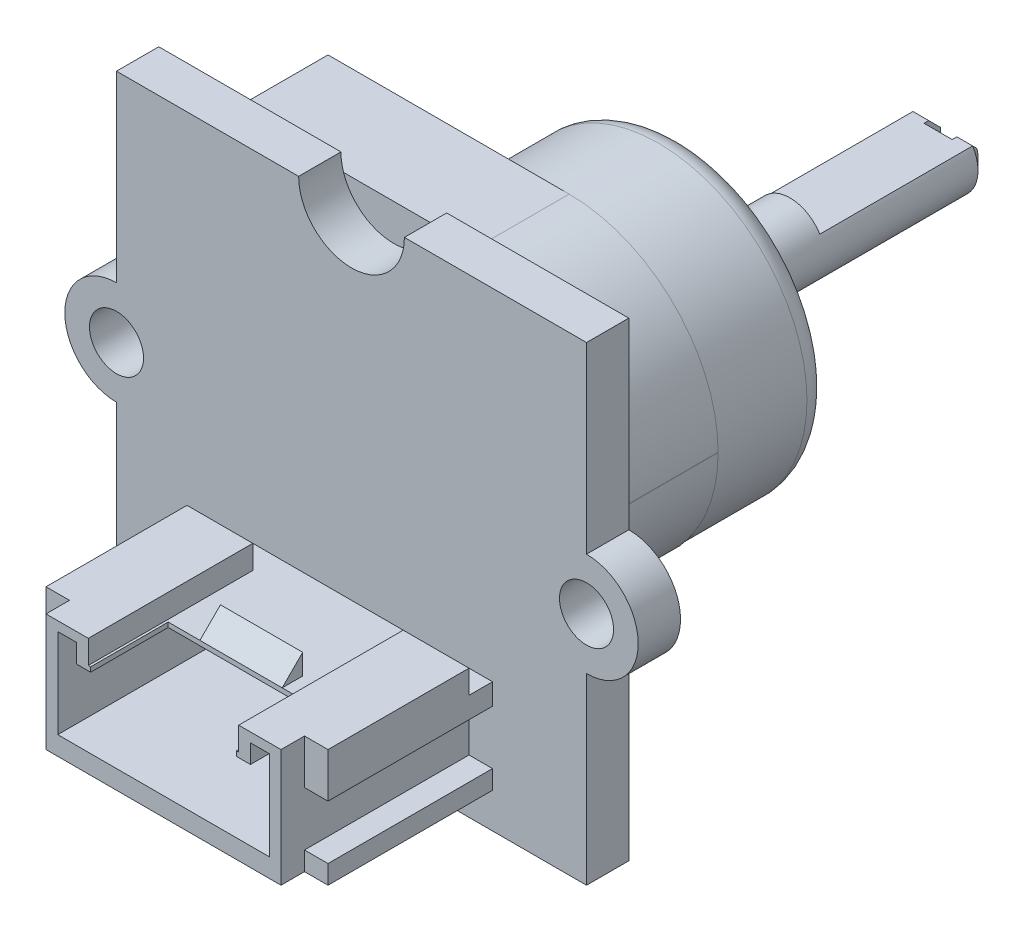
from build123d import *

# Parameters (mm, degrees)
ESQUISSE1_R             = 1.15
BOSS_EXTRU_1_DEPTH      = 1.8
BOSS_EXTRU_2_DEPTH      = 8
ENL_V_MAT_EXTRU_1_DEPTH = 7
ESQUISSE4_W             = 3.5
ESQUISSE4_H             = 0.873592076
ENL_V_MAT_EXTRU_2_DEPTH = 1
ESQUISSE5_W             = 1
ESQUISSE5_H             = 1
ENL_V_MAT_EXTRU_3_DEPTH = 11
ESQUISSE6_W             = 6.2
ESQUISSE6_H             = 3.3
ENL_V_MAT_EXTRU_4_DEPTH = 1
CHANFREIN1_SIZE         = 1
BOSS_EXTRU_3_DEPTH      = 4
ESQUISSE8_R             = 6.32
BOSS_EXTRU_4_DEPTH      = 4.8
CONG_1_R                = 1
ESQUISSE10_R            = 1.75
BOSS_EXTRU_5_DEPTH      = 1.6
CONG_2_R                = 1
ESQUISSE11_R            = 1.5
BOSS_EXTRU_6_DEPTH      = 10
ESQUISSE12_W            = 2.890262719
ESQUISSE12_H            = 1.095500593
ENL_V_MAT_EXTRU_7_DEPTH = 7
CHANFREIN2_SIZE         = 0.5
ESQUISSE13_W            = 1.2
ESQUISSE13_H            = 2.827300788
ENL_V_MAT_EXTRU_8_DEPTH = 0.7


with BuildPart() as part:
    # Esquisse1 → Boss.-Extru.1 (new body)
    with BuildSketch(Plane.XY):
        with BuildLine():
            Line((-12.744645331, 10.992907801), (-4.994645331, 10.992907801))
            ThreePointArc((-4.994645331, 10.992907801), (-2.744645331, 8.742907801), (-0.494645331, 10.992907801))
            Line((-0.494645331, 10.992907801), (7.255354669, 10.992907801))
            Line((7.255354669, 10.992907801), (7.255354669, 3.192907801))
            ThreePointArc((7.255354669, 3.192907801), (9.455354669, 0.992907801), (7.255354669, -1.207092199))
            Line((7.255354669, -1.207092199), (7.255354669, -9.007092199))
            Line((7.255354669, -9.007092199), (-0.494645331, -9.007092199))
            ThreePointArc((-0.494645331, -9.007092199), (-2.744645331, -6.757092199), (-4.994645331, -9.007092199))
            Line((-4.994645331, -9.007092199), (-12.744645331, -9.007092199))
            Line((-12.744645331, -9.007092199), (-12.744645331, -1.207092199))
            ThreePointArc((-12.744645331, -1.207092199), (-14.944645331, 0.992907801), (-12.744645331, 3.192907801))
            Line((-12.744645331, 3.192907801), (-12.744645331, 10.992907801))
        make_face()
        with Locations((-12.744645331, 0.992907801)):
            Circle(ESQUISSE1_R, mode=Mode.SUBTRACT)
        with Locations((7.255354669, 0.992907801)):
            Circle(ESQUISSE1_R, mode=Mode.SUBTRACT)
    extrude(amount=BOSS_EXTRU_1_DEPTH)

    # Esquisse2 → Boss.-Extru.2 (add)
    with BuildSketch(Plane.XY.offset(1.8)):
        Polygon((-8.744645331, -7.507092199), (3.255354669, -7.507092199), (3.255354669, -6.707092199), (2.255354669, -6.707092199), (2.255354669, -4.407092199), (3.255354669, -4.407092199), (3.255354669, -2.507092199), (-8.744645331, -2.507092199), (-8.744645331, -4.407092199), (-7.744645331, -4.407092199), (-7.744645331, -6.707092199), (-8.744645331, -6.707092199), align=None)
    extrude(amount=BOSS_EXTRU_2_DEPTH)

    # Esquisse3 → Enlèv. mat.-Extru.1 (cut)
    with BuildSketch(Plane.XY.offset(9.8)):
        Polygon((-6.444645331, -3.707092199), (0.955354669, -3.707092199), (0.955354669, -2.907092199), (1.755354669, -2.907092199), (1.755354669, -3.707092199), (1.755354669, -6.707092199), (-7.244645331, -6.707092199), (-7.244645331, -3.707092199), (-7.244645331, -2.907092199), (-6.444645331, -2.907092199), align=None)
    extrude(amount=-ENL_V_MAT_EXTRU_1_DEPTH, mode=Mode.SUBTRACT)

    # Esquisse4 → Enlèv. mat.-Extru.2 (cut)
    with BuildSketch(Plane(origin=(0, -2.507092199, 0), x_dir=(1, 0, 0), z_dir=(0, 1, 0))):
        Polygon((-8.744645331, -1.8), (3.255354669, -1.8), (3.255354669, -2.8), (0.455354669, -2.8), (0.455354669, -9.8), (-5.944645331, -9.8), (-5.944645331, -2.8), (-8.744645331, -2.8), align=None)
        with Locations((-2.744645331, -6.063203962)):
            Rectangle(ESQUISSE4_W, ESQUISSE4_H, mode=Mode.SUBTRACT)
    extrude(amount=-ENL_V_MAT_EXTRU_2_DEPTH, mode=Mode.SUBTRACT)

    # Esquisse5 → Enlèv. mat.-Extru.3 (cut)
    with BuildSketch(Plane(origin=(0, -2.507092199, 0), x_dir=(1, 0, 0), z_dir=(0, 1, 0))):
        with Locations((-8.244645331, -9.3)):
            Rectangle(ESQUISSE5_W, ESQUISSE5_H)
        with Locations((2.755354669, -9.3)):
            Rectangle(ESQUISSE5_W, ESQUISSE5_H)
    extrude(amount=-ENL_V_MAT_EXTRU_3_DEPTH, mode=Mode.SUBTRACT)

    # Esquisse6 → Enlèv. mat.-Extru.4 (cut)
    with BuildSketch(Plane(origin=(0, -3.507092199, 0), x_dir=(1, 0, 0), z_dir=(0, 1, 0))):
        with Locations((-2.744645331, -8.15)):
            Rectangle(ESQUISSE6_W, ESQUISSE6_H)
    extrude(amount=-ENL_V_MAT_EXTRU_4_DEPTH, mode=Mode.SUBTRACT)

    # Chanfrein1
    # the kernel refuses this chamfer: 1 mm, written as the material it takes off along each edge
    with BuildSketch(Plane(origin=(1.577037657, -2.507092199, 6.5), x_dir=(0, -0.9996219169112968, 0.027495876610586487), z_dir=(-1, 0, 0))) as chanfrein1_piece_1_section:
        Polygon((CHANFREIN1_SIZE * 0.999621916911, -CHANFREIN1_SIZE * 0.0274958766106), (-CHANFREIN1_SIZE * 0.0274958766106, -CHANFREIN1_SIZE * 0.999621916911), (0, 0), align=None)
    chanfrein1_piece_1 = extrude(amount=6.071682988, mode=Mode.PRIVATE)
    chanfrein1_piece_1 = split(chanfrein1_piece_1, bisect_by=Plane(origin=(0.455354669, -3.107092199, 6.3), z_dir=(-1, 0, 0)), keep=Keep.TOP, mode=Mode.PRIVATE)
    add(chanfrein1_piece_1, mode=Mode.SUBTRACT)

    # Esquisse7 → Boss.-Extru.3 (add)
    with BuildSketch(Plane(origin=(0, 0, 0), x_dir=(-1, 0, 0), z_dir=(0, 0, -1))):
        with BuildLine():
            Line((9.544645331, 10.292907801), (-0.715354669, 10.292907801))
            ThreePointArc((-0.715354669, 10.292907801), (-5.198411662, 8.435964794), (-7.055354669, 3.952907801))
            Line((-7.055354669, 3.952907801), (-7.055354669, 3.932907801))
            ThreePointArc((-7.055354669, 3.932907801), (-5.198411662, -0.550149191), (-0.715354669, -2.407092199))
            Line((-0.715354669, -2.407092199), (9.544645331, -2.407092199))
            Line((9.544645331, -2.407092199), (9.544645331, 10.292907801))
        make_face()
    extrude(amount=BOSS_EXTRU_3_DEPTH)

    # Esquisse8 → Boss.-Extru.4 (add)
    with BuildSketch(Plane(origin=(0, 0, -4), x_dir=(-1, 0, 0), z_dir=(0, 0, -1))):
        with Locations((-0.715354669, 3.952907801)):
            Circle(ESQUISSE8_R)
    extrude(amount=BOSS_EXTRU_4_DEPTH)

    # Congé1
    cong_1_edges = [part.edges().sort_by_distance(p)[0] for p in [
        (7.035354669, 3.952907801, -8.8),
    ]]
    fillet(cong_1_edges, radius=CONG_1_R)

    # Esquisse10 → Boss.-Extru.5 (add)
    with BuildSketch(Plane(origin=(0, 0, -8.8), x_dir=(-1, 0, 0), z_dir=(0, 0, -1))):
        with Locations((-0.715354669, 3.952907801)):
            Circle(ESQUISSE10_R)
    extrude(amount=BOSS_EXTRU_5_DEPTH)

    # Congé2
    cong_2_edges = [part.edges().sort_by_distance(p)[0] for p in [
        (2.465354669, 3.952907801, -8.8),
    ]]
    fillet(cong_2_edges, radius=CONG_2_R)

    # Esquisse11 → Boss.-Extru.6 (add)
    with BuildSketch(Plane(origin=(0, 0, -10.4), x_dir=(-1, 0, 0), z_dir=(0, 0, -1))):
        with Locations((-0.715354669, 3.952907801)):
            Circle(ESQUISSE11_R)
    extrude(amount=BOSS_EXTRU_6_DEPTH)

    # Esquisse12 → Enlèv. mat.-Extru.7 (cut)
    with BuildSketch(Plane(origin=(0, 0, -20.4), x_dir=(-1, 0, 0), z_dir=(0, 0, -1))):
        with Locations((-0.539081064, 5.300658098)):
            Rectangle(ESQUISSE12_W, ESQUISSE12_H)
    extrude(amount=-ENL_V_MAT_EXTRU_7_DEPTH, mode=Mode.SUBTRACT)

    # Chanfrein2
    chanfrein2_edges = [part.edges().sort_by_distance(p)[0] for p in [
        (1.131715912, 2.511851482, -20.4),
        (0.715354669, 4.752907801, -20.4),
    ]]
    chamfer(chanfrein2_edges, length=CHANFREIN2_SIZE)

    # Esquisse13 → Enlèv. mat.-Extru.8 (cut)
    with BuildSketch(Plane(origin=(0, 0, -20.4), x_dir=(-1, 0, 0), z_dir=(0, 0, -1))):
        with Locations((-0.715354669, 3.515442174)):
            Rectangle(ESQUISSE13_W, ESQUISSE13_H)
    extrude(amount=-ENL_V_MAT_EXTRU_8_DEPTH, mode=Mode.SUBTRACT)


solid = part.part
